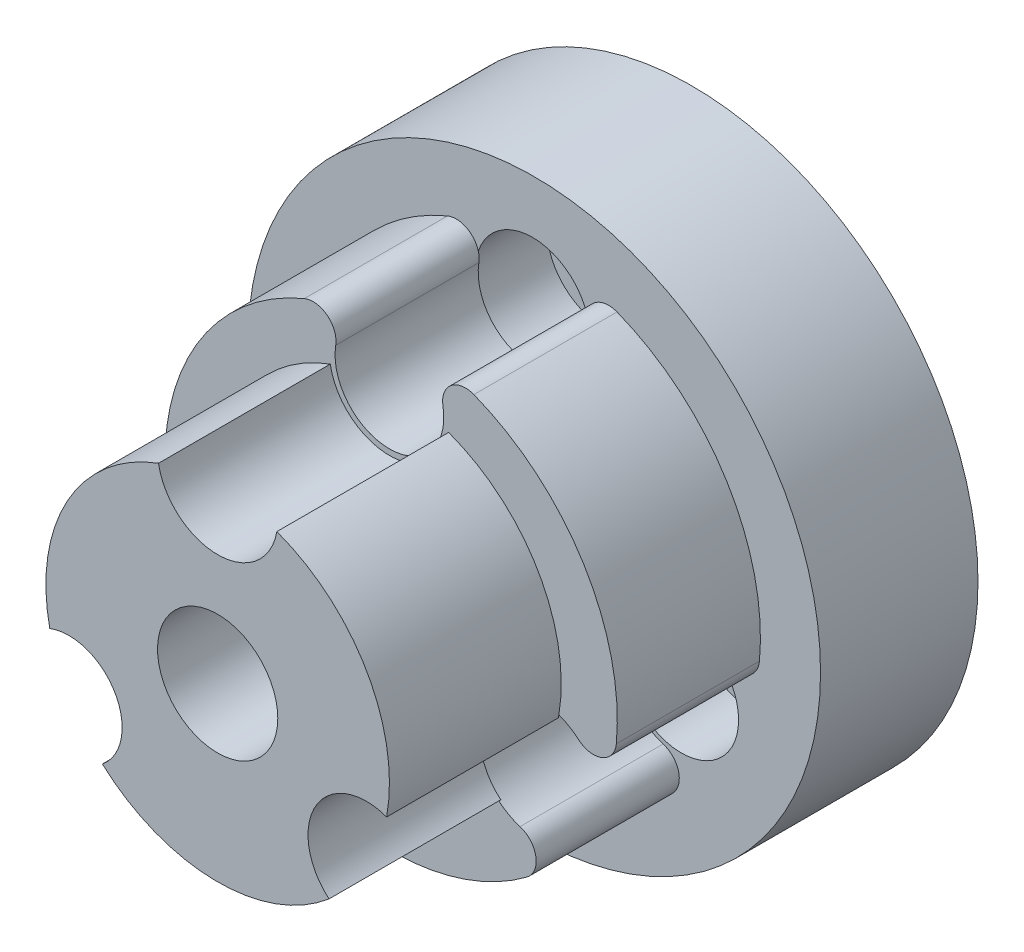
from build123d import *

# Parameters (mm, degrees)
SKETCH2_R           = 10
SKETCH2_R_2         = 2.1
SKETCH2_R_3         = 1.2
BOSS_EXTRUDE1_DEPTH = 3
SKETCH3_R           = 10
SKETCH3_R_2         = 2
SKETCH3_R_3         = 2.1
BOSS_EXTRUDE2_DEPTH = 2.5
SKETCH4_R           = 2.1
BOSS_EXTRUDE3_DEPTH = 5
FILLET1_R           = 0.8
SKETCH5_R           = 2.1
BOSS_EXTRUDE4_DEPTH = 6


with BuildPart() as part:
    # Sketch2 → Boss-Extrude1 (new body)
    with BuildSketch(Plane.XY.offset(-96.191169136)):
        Circle(SKETCH2_R)
        Circle(SKETCH2_R_2, mode=Mode.SUBTRACT)
        with Locations((-0.05897353, 6.133133301)):
            Circle(SKETCH2_R_3, mode=Mode.SUBTRACT)
        with Locations((5.137178892, -2.866866699)):
            Circle(SKETCH2_R_3, mode=Mode.SUBTRACT)
        with Locations((-5.255125953, -2.866866699)):
            Circle(SKETCH2_R_3, mode=Mode.SUBTRACT)
    extrude(amount=BOSS_EXTRUDE1_DEPTH)

    # Sketch3 → Boss-Extrude2 (add)
    with BuildSketch(Plane.XY.offset(-93.191169136)):
        Circle(SKETCH3_R)
        with Locations((-5.255125953, -2.866866699)):
            Circle(SKETCH3_R_2, mode=Mode.SUBTRACT)
        with Locations((-0.05897353, 6.133133301)):
            Circle(SKETCH3_R_2, mode=Mode.SUBTRACT)
        with Locations((5.137178892, -2.866866699)):
            Circle(SKETCH3_R_2, mode=Mode.SUBTRACT)
        Circle(SKETCH3_R_3, mode=Mode.SUBTRACT)
    extrude(amount=BOSS_EXTRUDE2_DEPTH)

    # Sketch4 → Boss-Extrude3 (add)
    with BuildSketch(Plane.XY.offset(-90.691169136)):
        with BuildLine():
            ThreePointArc((7.264990173, -3.103210883), (6.783257612, 4.049372318), (0.715851765, 7.8675))
            ThreePointArc((0.715851765, 7.8675), (-0.040708899, 4.233646925), (-0.867006302, 7.852279928))
            ThreePointArc((-0.867006302, 7.852279928), (-6.879264147, 3.884034604), (-7.171380747, -3.313804186))
            ThreePointArc((-7.171380747, -3.313804186), (-3.527763738, -1.924526353), (-6.668183396, -4.236192889))
            ThreePointArc((-6.668183396, -4.236192889), (-0.191069364, -7.897689061), (6.455528982, -4.553695814))
            ThreePointArc((6.455528982, -4.553695814), (3.267691347, -1.823575878), (7.264990173, -3.103210883))
        make_face()
        Circle(SKETCH4_R, mode=Mode.SUBTRACT)
    extrude(amount=BOSS_EXTRUDE3_DEPTH)

    # Fillet1
    # the kernel refuses this fillet: 0.8 mm, written as the material it takes off along each edge
    with BuildSketch(Plane(origin=(-0.867006302, 7.852279928, -90.691169136), x_dir=(-0.9684268820768696, -0.24929776186494912, 0), z_dir=(0, 0, 1))) as fillet1_piece_1:
        with BuildLine():
            CenterArc((2.122639751, 0.791949539), FILLET1_R, 156.548445833, 121.586747485)
            ThreePointArc((1.388722227, 1.110328352), (0.832290223, 0.382651946), (0, 0))
            ThreePointArc((0, 0), (1.117923602, -0.079498301), (2.235847204, 0))
        make_face()
    extrude(amount=10.589618011, mode=Mode.SUBTRACT)
    with BuildSketch(Plane(origin=(-7.171380747, -3.313804186, -90.691169136), x_dir=(-0.2672810953743128, 0.9636186050795758, 0), z_dir=(0, 0, 1))) as fillet1_piece_2:
        with BuildLine():
            CenterArc((2.423675061, -0.789487911), FILLET1_R, 80.701479552, 124.454730774)
            ThreePointArc((1.699553301, -1.129558017), (1.007651544, -0.327237606), (0, 0))
            ThreePointArc((0, 0), (1.276468866, 0.103806875), (2.552937731, 0))
        make_face()
    extrude(amount=11.382344328, mode=Mode.SUBTRACT)
    with BuildSketch(Plane(origin=(-6.668183396, -4.236192889, -90.691169136), x_dir=(0.9674204056157966, -0.2531753518772465, 0), z_dir=(0, 0, 1))) as fillet1_piece_3:
        with BuildLine():
            CenterArc((2.455521009, -0.684038404), FILLET1_R, 121.234961486, 124.454730774)
            ThreePointArc((2.126178356, -1.413101787), (1.005630009, -0.793004992), (0, 0))
            ThreePointArc((0, 0), (1.020340965, -0.285219915), (2.040681929, 0))
        make_face()
    extrude(amount=11.382344328, mode=Mode.SUBTRACT)
    with BuildSketch(Plane(origin=(6.455528982, -4.553695814, -90.691169136), x_dir=(-0.9836137954546407, -0.18028838396113095, 0), z_dir=(0, 0, 1))) as fillet1_piece_4:
        with BuildLine():
            CenterArc((2.356185075, 0.708813813), FILLET1_R, 116.541300521, 125.835667041)
            ThreePointArc((1.998710841, 1.42450381), (0.943696464, 0.790346579), (0, 0))
            ThreePointArc((0, 0), (0.99263164, 0.244025278), (1.98526328, 0))
        make_face()
    extrude(amount=11.13598817, mode=Mode.SUBTRACT)
    with BuildSketch(Plane(origin=(7.264990173, -3.103210883, -90.691169136), x_dir=(0.2451881288110309, 0.969475518767826, 0), z_dir=(0, 0, 1))) as fillet1_piece_5:
        with BuildLine():
            CenterArc((2.33012209, 0.790288667), FILLET1_R, 153.100934038, 125.835667041)
            ThreePointArc((1.616678166, 1.152224804), (0.94996865, 0.377392996), (0, 0))
            ThreePointArc((0, 0), (1.227197634, -0.095899413), (2.454395268, 0))
        make_face()
    extrude(amount=11.13598817, mode=Mode.SUBTRACT)
    with BuildSketch(Plane(origin=(0.715851765, 7.8675, -90.691169136), x_dir=(0.6159695110319643, -0.7877699927510841, 0), z_dir=(0, 0, 1))) as fillet1_piece_6:
        with BuildLine():
            CenterArc((2.152431859, 0.70697997), FILLET1_R, 120.508273334, 121.586747485)
            ThreePointArc((1.746301639, 1.396224661), (0.823506332, 0.760204236), (0, 0))
            ThreePointArc((0, 0), (0.889013284, 0.22087306), (1.778026567, 0))
        make_face()
    extrude(amount=10.589618011, mode=Mode.SUBTRACT)

    # Sketch5 → Boss-Extrude4 (add)
    with BuildSketch(Plane.XY.offset(-85.691169136)):
        with BuildLine():
            ThreePointArc((5.84214559, -0.951667659), (5.152070119, 3.107191821), (2.00838279, 5.765720437))
            ThreePointArc((2.00838279, 5.765720437), (-0.05897353, 4.033382276), (-2.126329851, 5.765720437))
            ThreePointArc((-2.126329851, 5.765720437), (-5.315006226, 3.026940535), (-5.924054987, -1.132101661))
            ThreePointArc((-5.924054987, -1.132101661), (-3.644953029, -1.937232928), (-4.087239877, -4.313558756))
            ThreePointArc((-4.087239877, -4.313558756), (-0.150972365, -5.866161342), (3.831051219, -4.434985289))
            ThreePointArc((3.831051219, -4.434985289), (3.369772867, -1.846454355), (5.84214559, -0.951667659))
        make_face()
        with Locations(Location((-0.05897353, 0.133133301, 0), (0, 0, 205.878507887))):
            Circle(SKETCH5_R, mode=Mode.SUBTRACT)
    extrude(amount=BOSS_EXTRUDE4_DEPTH)


solid = part.part
